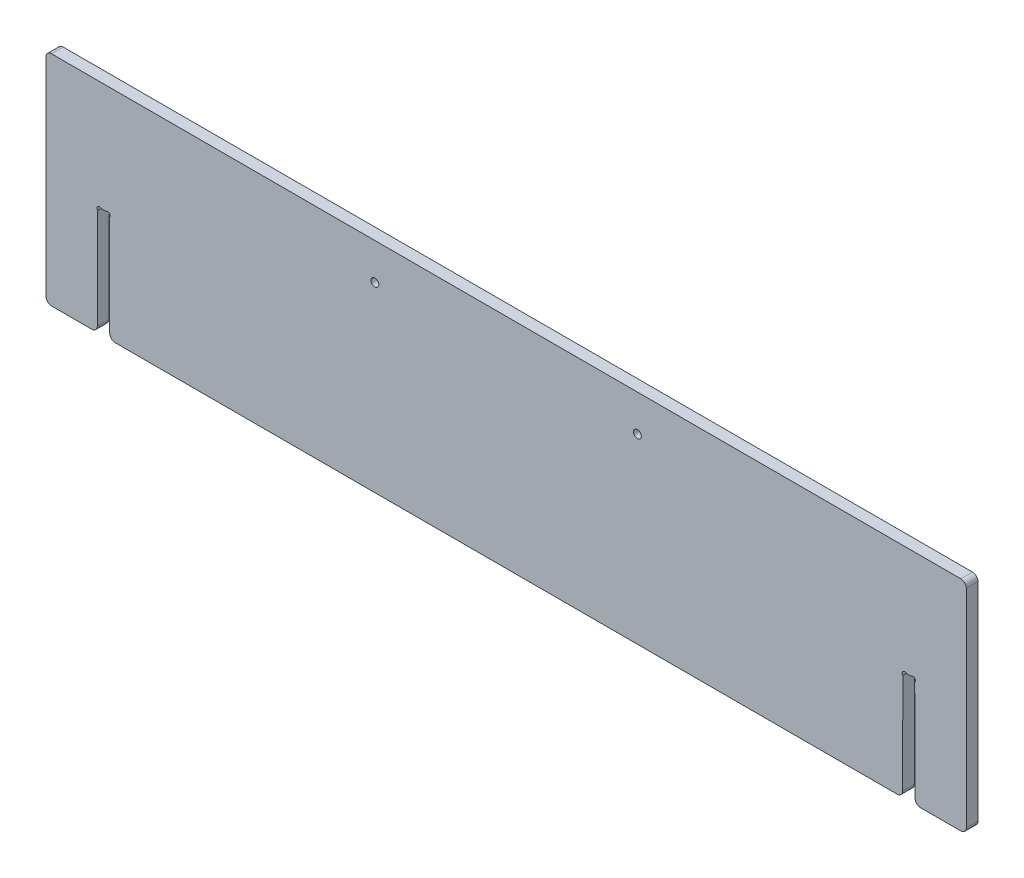
from build123d import *

# Parameters (mm, degrees)
ESQUISSE1_W         = 590.5
ESQUISSE1_H         = 280.25
BOSS_EXTRUDE1_DEPTH = 15
CUT_EXTRUDE1_DEPTH  = 654.800667253
ESQUISSE3_R         = 5
CUT_EXTRUDE2_DEPTH  = 654.800667253
CONG_1_R            = 7


with BuildPart() as part:
    # Esquisse1 → Boss-Extrude1 (new body)
    with BuildSketch(Plane.XY):
        with Locations((295.25, 140.125)):
            Rectangle(ESQUISSE1_W, ESQUISSE1_H)
    extrude(amount=BOSS_EXTRUDE1_DEPTH)

    # Esquisse2 → Cut-Extrude1 (cut, through all)
    with BuildSketch(Plane.XY.offset(15)):
        with BuildLine():
            Line((70.977649355, 140.125), (76.647350645, 140.125))
            ThreePointArc((76.647350645, 140.125), (76.980108702, 140.181987765), (77.274940482, 140.346455848))
            ThreePointArc((77.274940482, 140.346455848), (81.406698158, 140.130786526), (81.644207297, 136.00022674))
            ThreePointArc((81.644207297, 136.00022674), (81.481699427, 135.705678195), (81.426062442, 135.373906919))
            Line((81.426062442, 135.373906919), (81.8125, 0))
            Line((81.8125, 0), (65.8125, 0))
            Line((65.8125, 0), (66.198937558, 135.373906919))
            ThreePointArc((66.198937558, 135.373906919), (66.143300573, 135.705678195), (65.980792703, 136.00022674))
            ThreePointArc((65.980792703, 136.00022674), (66.218301842, 140.130786526), (70.350059518, 140.346455848))
            ThreePointArc((70.350059518, 140.346455848), (70.644891298, 140.181987765), (70.977649355, 140.125))
        make_face()
    extrude(amount=-CUT_EXTRUDE1_DEPTH, mode=Mode.SUBTRACT)

    # Esquisse3 → Cut-Extrude2 (cut, through all)
    with BuildSketch(Plane.XY.offset(15)):
        with Locations((422.0625, 233.541666667)):
            Circle(ESQUISSE3_R)
    extrude(amount=-CUT_EXTRUDE2_DEPTH, mode=Mode.SUBTRACT)

    # Congé1
    cong_1_edges = [part.edges().sort_by_distance(p)[0] for p in [
        (81.8125, 0, 7.5),
        (65.8125, 0, 7.5),
        (0, 0, 7.5),
        (0, 280.25, 7.5),
    ]]
    fillet(cong_1_edges, radius=CONG_1_R)

    # Symétrie1: part across plane


with BuildPart() as part_1:
    add(part.part)
    add(part.part.mirror(Plane(origin=(590.5, 0, 15), x_dir=(0, 0, 1), z_dir=(-1, 0, 0))))


solid = part_1.part
